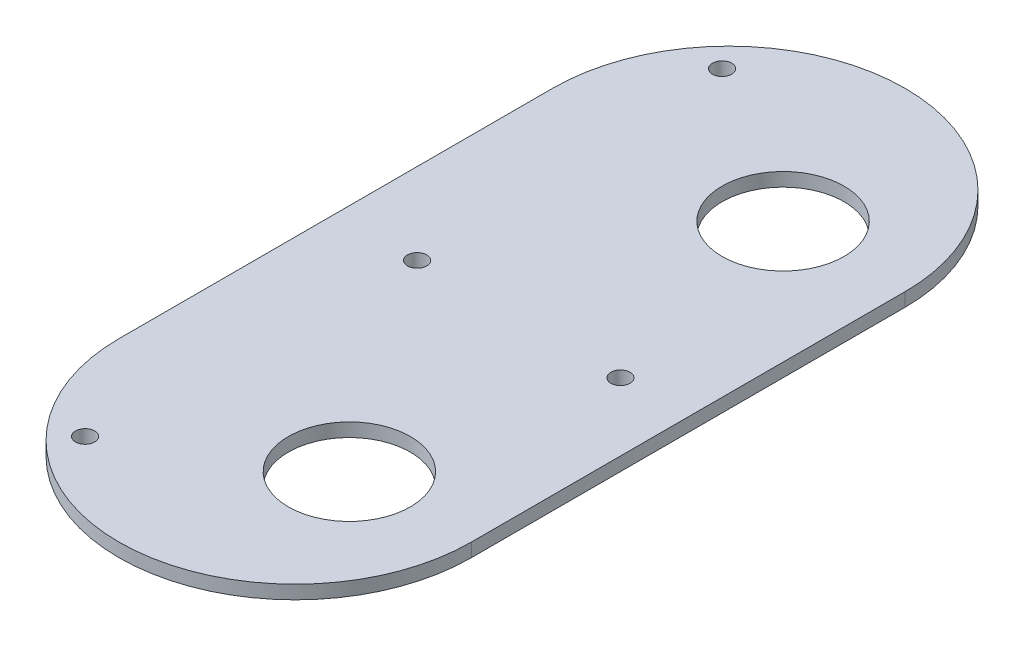
from build123d import *

# Parameters (mm, degrees)
SKETCH1_R                 = 14.2875
BOSS_EXTRUDE1_DEPTH       = 3.175
F_8_CLEARANCE_HOLE1_D     = 4.4958
F_8_CLEARANCE_HOLE1_DEPTH = 3.175
F_8_CLEARANCE_HOLE1_TIP   = 1.350674586


with BuildPart() as part:
    # Sketch1 → Boss-Extrude1 (new body)
    with BuildSketch(Plane(origin=(0, 0, 0), x_dir=(1, 0, 0), z_dir=(0, 1, 0))):
        with BuildLine():
            Line((-53.970534123, 50.8), (-53.970534123, -50.8))
            ThreePointArc((-53.970534123, -50.8), (-12.7, -92.070534123), (28.570534123, -50.8))
            Line((28.570534123, -50.8), (28.570534123, 50.8))
            ThreePointArc((28.570534123, 50.8), (-12.7, 92.070534123), (-53.970534123, 50.8))
        make_face()
        with Locations((0, 50.8)):
            Circle(SKETCH1_R, mode=Mode.SUBTRACT)
        with Locations((0, -50.8)):
            Circle(SKETCH1_R, mode=Mode.SUBTRACT)
    extrude(amount=BOSS_EXTRUDE1_DEPTH)

    # #8 Clearance Hole1
    with Locations(Plane(origin=(0, 3.175, 0), x_dir=(1, 0, 0), z_dir=(0, 1, 0))):
        with Locations((12.7, 0), (-38.1, 74.6125), (-38.1, -74.6125), (-34.925, 0)):
            Hole(F_8_CLEARANCE_HOLE1_D / 2, depth=F_8_CLEARANCE_HOLE1_DEPTH)
            with Locations((0, 0, -(F_8_CLEARANCE_HOLE1_DEPTH + F_8_CLEARANCE_HOLE1_TIP / 2))):  # 118° drill point
                Cone(0, F_8_CLEARANCE_HOLE1_D / 2, F_8_CLEARANCE_HOLE1_TIP, mode=Mode.SUBTRACT)


solid = part.part
